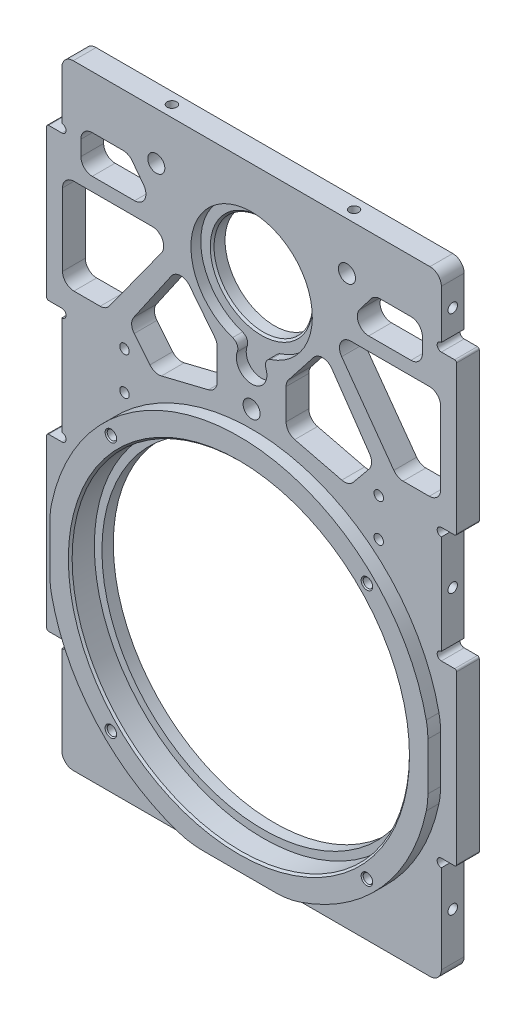
from build123d import *

# Parameters (mm, degrees)
SKETCH_1_W                   = 100
SKETCH_1_H                   = 246
SKETCH_1_R                   = 44.45
EXTRUDE_1_DEPTH              = 6
SKETCH_2_R                   = 13
CUT_EXTRUDE_1_DEPTH          = 6
SKETCH_3_R                   = 2
CUT_EXTRUDE_2_DEPTH          = 10
SKETCH_4_R                   = 16
CUT_EXTRUDE_3_DEPTH          = 2.6
SKETCH_5_R                   = 4.025
CUT_EXTRUDE_4_DEPTH          = 2.6
FILLET_1_R                   = 2
HOLE_WIZARD_1_D              = 4.5
HOLE_WIZARD_1_DEPTH          = 8.5
HOLE_WIZARD_1_CSINK_D        = 9.4
HOLE_WIZARD_1_CSINK_ANGLE    = 90
HOLE_WIZARD_1_TIP            = 1.351936393
SKETCH_17_R                  = 44.45
SKETCH_17_R_2                = 42.45
EXTRUDE_3_DEPTH              = 3
SKETCH_18_R                  = 50.45
SKETCH_18_R_2                = 44.45
EXTRUDE_4_DEPTH              = 3.35
SKETCH_20_R                  = 1.2
CUT_EXTRUDE_9_DEPTH          = 22.35
HOLE_WIZARD_M3_4_D           = 2.5
HOLE_WIZARD_M3_4_DEPTH       = 12.5
HOLE_WIZARD_M3_4_CSINK_D     = 3.05
HOLE_WIZARD_M3_4_CSINK_ANGLE = 90
HOLE_WIZARD_M3_4_TIP         = 0.751075774
CHAMFER_1_SIZE               = 0.5
SKETCH_23_W                  = 100
SKETCH_23_H                  = 12
CUT_EXTRUDE_11_DEPTH         = 10
SKETCH_24_W                  = 8
SKETCH_24_H                  = 45
EXTRUDE_5_DEPTH              = 6
CUT_EXTRUDE_START            = -3.35
CUT_EXTRUDE_12_DEPTH         = 3.35
FILLET_2_R                   = 20
SKETCH_26_R                  = 1.1
CUT_EXTRUDE_13_DEPTH         = 10
FILLET_3_R                   = 0.5
SKETCH_27_W                  = 8
SKETCH_27_H                  = 40
EXTRUDE_6_DEPTH              = 6
SKETCH_28_R                  = 1.1
CUT_EXTRUDE_14_DEPTH         = 10
FILLET_5_R                   = 0.5
SKETCH_22_W                  = 100
SKETCH_22_H                  = 72
CUT_EXTRUDE_15_DEPTH         = 10
FILLET_6_R                   = 3
SKETCH_30_R                  = 1.25
CUT_EXTRUDE_17_DEPTH         = 8
HOLE_WIZARD_M3_6_AT_2_COUNT  = 2
HOLE_WIZARD_M3_6_AT_2_PITCH  = 73.414496731
HOLE_WIZARD_M3_6_AT_3_COUNT  = 2
HOLE_WIZARD_M3_6_AT_3_PITCH  = 137.264496731
SKETCH_33_R                  = 1.25
CUT_EXTRUDE_18_DEPTH         = 10
HOLE_WIZARD_M3_7_D           = 2.5
HOLE_WIZARD_M3_7_DEPTH       = 12.5
HOLE_WIZARD_M3_7_TIP         = 0.751075774
CHAMFER_2_SIZE               = 0.5
SKETCH_35_R                  = 1.25
CUT_EXTRUDE_19_DEPTH         = 6
HOLE_WIZARD_M3_8_AT_2_COUNT  = 2
HOLE_WIZARD_M3_8_AT_2_PITCH  = 48
SKETCH_38_W                  = 25
SKETCH_38_H                  = 3.146176546
CUT_EXTRUDE_20_DEPTH         = 3.35
FILLET_7_R                   = 20
CUT_EXTRUDE_21_DEPTH         = 10
FILLET_8_R                   = 3


# Read off the part's stored shape, not the designer's step: 切除-拉伸12
with BuildPart() as part:
    # 草图1 → 凸台-拉伸1 (new body)
    with BuildSketch(Plane.XY):
        Rectangle(SKETCH_1_W, SKETCH_1_H)
        Circle(SKETCH_1_R, mode=Mode.SUBTRACT)
    extrude(amount=EXTRUDE_1_DEPTH)

    # 草图2 → 切除-拉伸1 (cut)
    with BuildSketch(Plane.XY.offset(6)):
        with Locations((0, 84)):
            Circle(SKETCH_2_R)
    extrude(amount=-CUT_EXTRUDE_1_DEPTH, mode=Mode.SUBTRACT)

    # 草图3 → 切除-拉伸2 (cut)
    with BuildSketch(Plane.XY.offset(6)):
        with Locations((0, 55)):
            Circle(SKETCH_3_R)
        with Locations((-25.11473671, 98.5)):
            Circle(SKETCH_3_R)
        with Locations((25.11473671, 98.5)):
            Circle(SKETCH_3_R)
    extrude(amount=-CUT_EXTRUDE_2_DEPTH, mode=Mode.SUBTRACT)

    # 草图4 → 切除-拉伸3 (cut)
    with BuildSketch(Plane.XY.offset(6)):
        with Locations((0, 84)):
            Circle(SKETCH_4_R)
    extrude(amount=-CUT_EXTRUDE_3_DEPTH, mode=Mode.SUBTRACT)

    # 草图5 → 切除-拉伸4 (cut)
    with BuildSketch(Plane.XY.offset(6)):
        with Locations((0, 64.75)):
            Circle(SKETCH_5_R)
    extrude(amount=-CUT_EXTRUDE_4_DEPTH, mode=Mode.SUBTRACT)

    # 圆角1
    fillet_1_edges = [part.edges().sort_by_distance(p)[0] for p in [
        (-2.159811956, 68.146444805, 4.7),
        (2.159811956, 68.146444805, 4.7),
    ]]
    fillet(fillet_1_edges, radius=FILLET_1_R)

    # 打孔尺寸(%根据十字)槽沉头自攻螺钉的类型1
    with Locations(Plane(origin=(25.11473671, 98.5, 0), x_dir=(-1, 0, 0), z_dir=(0, 0, -1))):
        with Locations((0, 0), (50.22947342, 0), (25.11473671, -43.5)):
            CounterSinkHole(HOLE_WIZARD_1_D / 2, HOLE_WIZARD_1_CSINK_D / 2, depth=HOLE_WIZARD_1_DEPTH, counter_sink_angle=HOLE_WIZARD_1_CSINK_ANGLE)
            with Locations((0, 0, -(HOLE_WIZARD_1_DEPTH + HOLE_WIZARD_1_TIP / 2))):  # 118° drill point
                Cone(0, HOLE_WIZARD_1_D / 2, HOLE_WIZARD_1_TIP, mode=Mode.SUBTRACT)

    # 草图17 → 凸台-拉伸3 (add)
    with BuildSketch(Plane(origin=(0, 0, 0), x_dir=(-1, 0, 0), z_dir=(0, 0, -1))):
        Circle(SKETCH_17_R)
        Circle(SKETCH_17_R_2, mode=Mode.SUBTRACT)
    extrude(amount=-EXTRUDE_3_DEPTH)

    # 草图18 → 凸台-拉伸4 (add)
    with BuildSketch(Plane.XY.offset(6)):
        with Locations(Location((0, 0, 0), (0, 0, 172.341624676))):
            Circle(SKETCH_18_R)
        with Locations(Location((0, 0, 0), (0, 0, 180))):
            Circle(SKETCH_18_R_2, mode=Mode.SUBTRACT)
    extrude(amount=EXTRUDE_4_DEPTH)

    # 草图20 → 切除-拉伸9 (cut)
    with BuildSketch(Plane.XY.offset(9.35)):
        with Locations((33.728993463, 33.728993463)):
            Circle(SKETCH_20_R)
        with Locations((33.728993463, -33.728993463)):
            Circle(SKETCH_20_R)
        with Locations((-33.728993463, -33.728993463)):
            Circle(SKETCH_20_R)
        with Locations((-33.728993463, 33.728993463)):
            Circle(SKETCH_20_R)
    extrude(amount=-CUT_EXTRUDE_9_DEPTH, mode=Mode.SUBTRACT)

    # M3 螺纹孔4
    with Locations(Plane(origin=(33.728993463, 33.728993463, 9.35), x_dir=(1, 0, 0), z_dir=(0, 0, 1))):
        with Locations((0, 0), (0, -67.457986926), (-67.457986926, 0), (-67.457986926, -67.457986926)):
            CounterSinkHole(HOLE_WIZARD_M3_4_D / 2, HOLE_WIZARD_M3_4_CSINK_D / 2, depth=HOLE_WIZARD_M3_4_DEPTH, counter_sink_angle=HOLE_WIZARD_M3_4_CSINK_ANGLE)
            with Locations((0, 0, -(HOLE_WIZARD_M3_4_DEPTH + HOLE_WIZARD_M3_4_TIP / 2))):  # 118° drill point
                Cone(0, HOLE_WIZARD_M3_4_D / 2, HOLE_WIZARD_M3_4_TIP, mode=Mode.SUBTRACT)

    # 倒角1
    chamfer_1_edges = [part.edges().sort_by_distance(p)[0] for p in [
        (44.45, 0, 9.35),
    ]]
    chamfer(chamfer_1_edges, length=CHAMFER_1_SIZE)

    # 草图23 → 切除-拉伸11 (cut)
    with BuildSketch(Plane.XY.offset(6)):
        with Locations((0, 117)):
            Rectangle(SKETCH_23_W, SKETCH_23_H)
    extrude(amount=-CUT_EXTRUDE_11_DEPTH, mode=Mode.SUBTRACT)

    # 草图24 → 凸台-拉伸5 (add)
    with BuildSketch(Plane.XY.offset(6)):
        with Locations((50, 0)):
            Rectangle(SKETCH_24_W, SKETCH_24_H)
        with Locations((-50, 0)):
            Rectangle(SKETCH_24_W, SKETCH_24_H)
    extrude(amount=-EXTRUDE_5_DEPTH)

    # 切除-拉伸12 outline → 切除-拉伸12 (cut)
    with BuildSketch(Plane.XY.offset(9.35).offset(CUT_EXTRUDE_START)):
        with BuildLine():
            ThreePointArc((-49.8, 8.07232928), (-50.45, 0), (-49.8, -8.07232928))
            Line((-49.8, -8.07232928), (-49.8, 8.07232928))
        make_face()
        with BuildLine():
            Line((49.8, 8.07232928), (49.8, -8.07232928))
            ThreePointArc((49.8, -8.07232928), (50.45, 0), (49.8, 8.07232928))
        make_face()
    extrude(amount=CUT_EXTRUDE_12_DEPTH, mode=Mode.SUBTRACT)

    # 圆角2
    fillet_2_edges = [part.edges().sort_by_distance(p)[0] for p in [
        (-49.8, 8.07232928, 7.675),
        (-49.8, -8.07232928, 7.675),
        (49.8, 8.07232928, 7.675),
        (49.8, -8.07232928, 7.675),
    ]]
    fillet(fillet_2_edges, radius=FILLET_2_R)

    # 草图26 → 切除-拉伸13 (cut)
    with BuildSketch(Plane.XY.offset(6)):
        with Locations((50, -23.6)):
            Circle(SKETCH_26_R)
        with Locations((50, 23.6)):
            Circle(SKETCH_26_R)
        with Locations((-50, -23.6)):
            Circle(SKETCH_26_R)
        with Locations((-50, 23.6)):
            Circle(SKETCH_26_R)
    extrude(amount=-CUT_EXTRUDE_13_DEPTH, mode=Mode.SUBTRACT)

    # 圆角3
    fillet_3_edges = [part.edges().sort_by_distance(p)[0] for p in [
        (-54, 22.5, 3),
        (-54, -22.5, 3),
        (54, -22.5, 3),
        (54, 22.5, 3),
    ]]
    fillet(fillet_3_edges, radius=FILLET_3_R)

    # 草图27 → 凸台-拉伸6 (add)
    with BuildSketch(Plane.XY.offset(6)):
        with Locations((50, 73)):
            Rectangle(SKETCH_27_W, SKETCH_27_H)
        with Locations((-50, 73)):
            Rectangle(SKETCH_27_W, SKETCH_27_H)
    extrude(amount=-EXTRUDE_6_DEPTH)

    # 草图28 → 切除-拉伸14 (cut)
    with BuildSketch(Plane.XY.offset(6)):
        with Locations((50, 51.9)):
            Circle(SKETCH_28_R)
        with Locations((-50, 51.9)):
            Circle(SKETCH_28_R)
        with Locations((50, 94.1)):
            Circle(SKETCH_28_R)
        with Locations((-50, 94.1)):
            Circle(SKETCH_28_R)
    extrude(amount=-CUT_EXTRUDE_14_DEPTH, mode=Mode.SUBTRACT)

    # 圆角5
    fillet_5_edges = [part.edges().sort_by_distance(p)[0] for p in [
        (54, 53, 3),
        (54, 93, 3),
        (-54, 93, 3),
        (-54, 53, 3),
    ]]
    fillet(fillet_5_edges, radius=FILLET_5_R)

    # 草图22 → 切除-拉伸15 (cut)
    with BuildSketch(Plane.XY.offset(6)):
        with Locations((0, -87)):
            Rectangle(SKETCH_22_W, SKETCH_22_H)
    extrude(amount=-CUT_EXTRUDE_15_DEPTH, mode=Mode.SUBTRACT)

    # 圆角6
    fillet_6_edges = [part.edges().sort_by_distance(p)[0] for p in [
        (50, 111, 3),
        (-50, 111, 3),
        (50, -51, 3),
        (-50, -51, 3),
    ]]
    fillet(fillet_6_edges, radius=FILLET_6_R)

    # 草图30 → 切除-拉伸17 (cut)
    with BuildSketch(Plane(origin=(50, 0, 0), x_dir=(0, 0, -1), z_dir=(1, 0, 0))):
        with Locations(Location((-3, -35.664496731, 0), (0, 0, 90))):
            Circle(SKETCH_30_R)
        with Locations(Location((-3, 37.75, 0), (0, 0, 90))):
            Circle(SKETCH_30_R)
        with Locations(Location((-3, 101.6, 0), (0, 0, 90))):
            Circle(SKETCH_30_R)
    cut_extrude_17 = extrude(amount=-CUT_EXTRUDE_17_DEPTH, mode=Mode.SUBTRACT)

    # 草图32 → M3 螺纹孔6 (revolve, cut)
    with BuildSketch(Plane(origin=(50, -35.664496731, 3), x_dir=(0, 0, -1), z_dir=(0, 1, 0))):
        Polygon((0, 0), (0, 11.251075774), (1.25, 10.5), (1.25, 0), align=None)
    hole_wizard_m3_6 = revolve(axis=Axis((56.35, -35.664496731, 3), (-1, 0, 0)), mode=Mode.SUBTRACT)

    # M3 螺纹孔6 at 2: M3 螺纹孔6 ×2
    with Locations(*[(0, i * HOLE_WIZARD_M3_6_AT_2_PITCH, 0) for i in range(1, HOLE_WIZARD_M3_6_AT_2_COUNT)]):
        add(hole_wizard_m3_6, mode=Mode.SUBTRACT)

    # M3 螺纹孔6 at 3: M3 螺纹孔6 ×2
    with Locations(*[(0, i * HOLE_WIZARD_M3_6_AT_3_PITCH, 0) for i in range(1, HOLE_WIZARD_M3_6_AT_3_COUNT)]):
        add(hole_wizard_m3_6, mode=Mode.SUBTRACT)

    # 镜向2: 切除-拉伸17, M3 螺纹孔6 across plane
    add(cut_extrude_17.mirror(Plane(origin=(0, 0, 0), x_dir=(0, 0, 1), z_dir=(1, 0, 0))), mode=Mode.SUBTRACT)
    add(hole_wizard_m3_6.mirror(Plane(origin=(0, 0, 0), x_dir=(0, 0, 1), z_dir=(1, 0, 0))), mode=Mode.SUBTRACT)

    # 镜向2 copy 1 sketch → 镜向2 copy 1 (revolve, cut)
    with BuildSketch(Plane(origin=(-50, 37.75, 3), x_dir=(0, 0, -1), z_dir=(0, 1, 0))):
        Polygon((0, 0), (0, -11.251075774), (1.25, -10.5), (1.25, 0), align=None)
    revolve(axis=Axis((-56.35, 37.75, 3), (-1, 0, 0)), mode=Mode.SUBTRACT)

    # 镜向2 copy 2 sketch → 镜向2 copy 2 (revolve, cut)
    with BuildSketch(Plane(origin=(-50, 101.6, 3), x_dir=(0, 0, -1), z_dir=(0, 1, 0))):
        Polygon((0, 0), (0, -11.251075774), (1.25, -10.5), (1.25, 0), align=None)
    revolve(axis=Axis((-56.35, 101.6, 3), (-1, 0, 0)), mode=Mode.SUBTRACT)

    # 草图33 → 切除-拉伸18 (cut)
    with BuildSketch(Plane(origin=(0, 0, 0), x_dir=(-1, 0, 0), z_dir=(0, 0, -1))):
        with Locations((-33.5, 42)):
            Circle(SKETCH_33_R)
        with Locations(Location((33.5, 42, 0), (0, 0, 180))):
            Circle(SKETCH_33_R)
        with Locations((-33.5, 52)):
            Circle(SKETCH_33_R)
        with Locations(Location((33.5, 52, 0), (0, 0, 180))):
            Circle(SKETCH_33_R)
    extrude(amount=-CUT_EXTRUDE_18_DEPTH, mode=Mode.SUBTRACT)

    # M3 螺纹孔7
    with Locations(Plane(origin=(33.5, 42, 0), x_dir=(-1, 0, 0), z_dir=(0, 0, -1))):
        with Locations((0, 0), (0, 10), (67, 0), (67, 10)):
            Hole(HOLE_WIZARD_M3_7_D / 2, depth=HOLE_WIZARD_M3_7_DEPTH)
            with Locations((0, 0, -(HOLE_WIZARD_M3_7_DEPTH + HOLE_WIZARD_M3_7_TIP / 2))):  # 118° drill point
                Cone(0, HOLE_WIZARD_M3_7_D / 2, HOLE_WIZARD_M3_7_TIP, mode=Mode.SUBTRACT)

    # 倒角2
    chamfer_2_edges = [part.edges().sort_by_distance(p)[0] for p in [
        (-13, 84, 3.4),
    ]]
    chamfer(chamfer_2_edges, length=CHAMFER_2_SIZE)

    # 草图35 → 切除-拉伸19 (cut)
    with BuildSketch(Plane.XZ.offset(51)):
        with Locations((-24, 3)):
            Circle(SKETCH_35_R)
        with Locations(Location((24, 3, 0), (0, 0, 180))):
            Circle(SKETCH_35_R)
    cut_extrude_19 = extrude(amount=-CUT_EXTRUDE_19_DEPTH, mode=Mode.SUBTRACT)

    # 草图36 → M3 螺纹孔8 (revolve, cut)
    with BuildSketch(Plane(origin=(-24, -51, 3), x_dir=(0, 0, -1), z_dir=(1, 0, 0))):
        Polygon((0, 0), (0, 6.751075774), (1.25, 6), (1.25, 0), align=None)
    hole_wizard_m3_8 = revolve(axis=Axis((-24, -57.35, 3), (0, 1, 0)), mode=Mode.SUBTRACT)

    # M3 螺纹孔8 at 2: M3 螺纹孔8 ×2
    with Locations(*[(i * HOLE_WIZARD_M3_8_AT_2_PITCH, 0, 0) for i in range(1, HOLE_WIZARD_M3_8_AT_2_COUNT)]):
        add(hole_wizard_m3_8, mode=Mode.SUBTRACT)

    # 镜向3: 切除-拉伸19, M3 螺纹孔8 across plane
    add(cut_extrude_19.mirror(Plane(origin=(0, 30, 0), x_dir=(0, 0, 1), z_dir=(0, -1, 0))), mode=Mode.SUBTRACT)
    add(hole_wizard_m3_8.mirror(Plane(origin=(0, 30, 0), x_dir=(0, 0, 1), z_dir=(0, -1, 0))), mode=Mode.SUBTRACT)

    # 镜向3 copy 1 sketch → 镜向3 copy 1 (revolve, cut)
    with BuildSketch(Plane(origin=(24, 111, 3), x_dir=(0, 0, -1), z_dir=(1, 0, 0))):
        Polygon((0, 0), (0, -6.751075774), (1.25, -6), (1.25, 0), align=None)
    revolve(axis=Axis((24, 117.35, 3), (0, 1, 0)), mode=Mode.SUBTRACT)

    # 草图38 → 切除-拉伸20 (cut)
    with BuildSketch(Plane.XY.offset(9.35)):
        with Locations((0, -50.45)):
            Rectangle(SKETCH_38_W, SKETCH_38_H)
    extrude(amount=-CUT_EXTRUDE_20_DEPTH, mode=Mode.SUBTRACT)

    # 圆角7
    fillet_7_edges = [part.edges().sort_by_distance(p)[0] for p in [
        (-12.5, -48.876911727, 7.675),
        (12.5, -48.876911727, 7.675),
    ]]
    fillet(fillet_7_edges, radius=FILLET_7_R)

    # 草图39 → 切除-拉伸21 (cut)
    with BuildSketch(Plane.XY.offset(6)):
        Polygon((49.826750221, 83.567594439), (20.29642909, 83.567594439), (38.381246187, 58.505887328), (49.826750221, 58.505887328), align=None)
        Polygon((44.992011448, 87.119647415), (24.818526775, 87.119647415), (32.362489755, 97.085129376), (44.992011448, 97.085129376), align=None)
        Polygon((32.362489755, 58.505887328), (18.844954817, 78.140846836), (9.076809133, 65.708661419), (9.076809133, 54.263157385), (25.603722286, 50.217763717), align=None)
        Polygon((-25.603722286, 50.217763717), (-32.362489755, 58.505887328), (-18.844954817, 78.140846836), (-9.076809133, 65.708661419), (-9.076809133, 54.263157385), align=None)
        Polygon((-44.992011448, 97.085129376), (-44.992011448, 87.119647415), (-24.818526775, 87.119647415), (-32.362489755, 97.085129376), align=None)
        Polygon((-49.826750221, 58.505887328), (-49.826750221, 83.567594439), (-20.29642909, 83.567594439), (-38.381246187, 58.505887328), align=None)
    extrude(amount=-CUT_EXTRUDE_21_DEPTH, mode=Mode.SUBTRACT)

    # 圆角8
    fillet_8_edges = [part.edges().sort_by_distance(p)[0] for p in [
        (44.992011448, 97.085129376, 3),
        (44.992011448, 87.119647415, 3),
        (24.818526775, 87.119647415, 3),
        (32.362489755, 97.085129376, 3),
        (9.076809133, 54.263157385, 3),
        (9.076809133, 65.708661419, 3),
        (18.844954817, 78.140846836, 3),
        (32.362489755, 58.505887328, 3),
        (25.603722286, 50.217763717, 3),
        (-9.076809133, 54.263157385, 3),
        (-25.603722286, 50.217763717, 3),
        (-32.362489755, 58.505887328, 3),
        (-18.844954817, 78.140846836, 3),
        (-9.076809133, 65.708661419, 3),
        (-44.992011448, 97.085129376, 3),
        (-32.362489755, 97.085129376, 3),
        (-24.818526775, 87.119647415, 3),
        (-44.992011448, 87.119647415, 3),
        (-38.381246187, 58.505887328, 3),
        (-49.826750221, 58.505887328, 3),
        (-49.826750221, 83.567594439, 3),
        (-20.29642909, 83.567594439, 3),
        (49.826750221, 83.567594439, 3),
        (49.826750221, 58.505887328, 3),
        (38.381246187, 58.505887328, 3),
        (20.29642909, 83.567594439, 3),
    ]]
    fillet(fillet_8_edges, radius=FILLET_8_R)


solid = part.part
